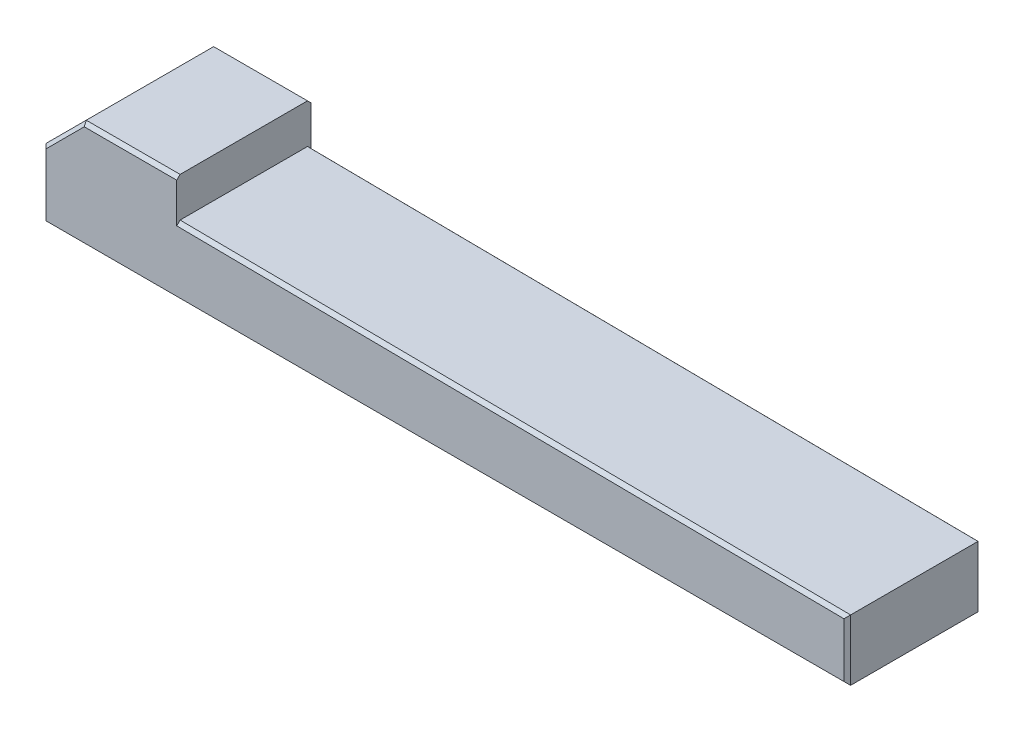
from build123d import *

# Parameters (mm, degrees)
BASEKEY_DEPTH = 50
CHAMFER1_SIZE = 2.5


with BuildPart() as part:
    # Sketch1 → BaseKey (new, symmetric)
    with BuildSketch(Plane.XY):
        Polygon((0, 0), (600, 0), (600, 45.499518485), (100, 50.500053502), (100, 80), (30, 80), (0, 50), align=None)
    extrude(amount=BASEKEY_DEPTH, both=True)

    # Chamfer1
    chamfer1_edges = [part.edges().sort_by_distance(p)[0] for p in [
        (65, 80, -50),
        (15, 65, -50),
        (0, 25, -50),
        (300, 0, -50),
        (600, 22.749759242, -50),
        (350, 47.999785993, -50),
        (0, 25, 50),
        (15, 65, 50),
        (65, 80, 50),
        (300, 0, 50),
        (600, 22.749759242, 50),
        (350, 47.999785993, 50),
    ]]
    chamfer(chamfer1_edges, length=CHAMFER1_SIZE)


solid = part.part
